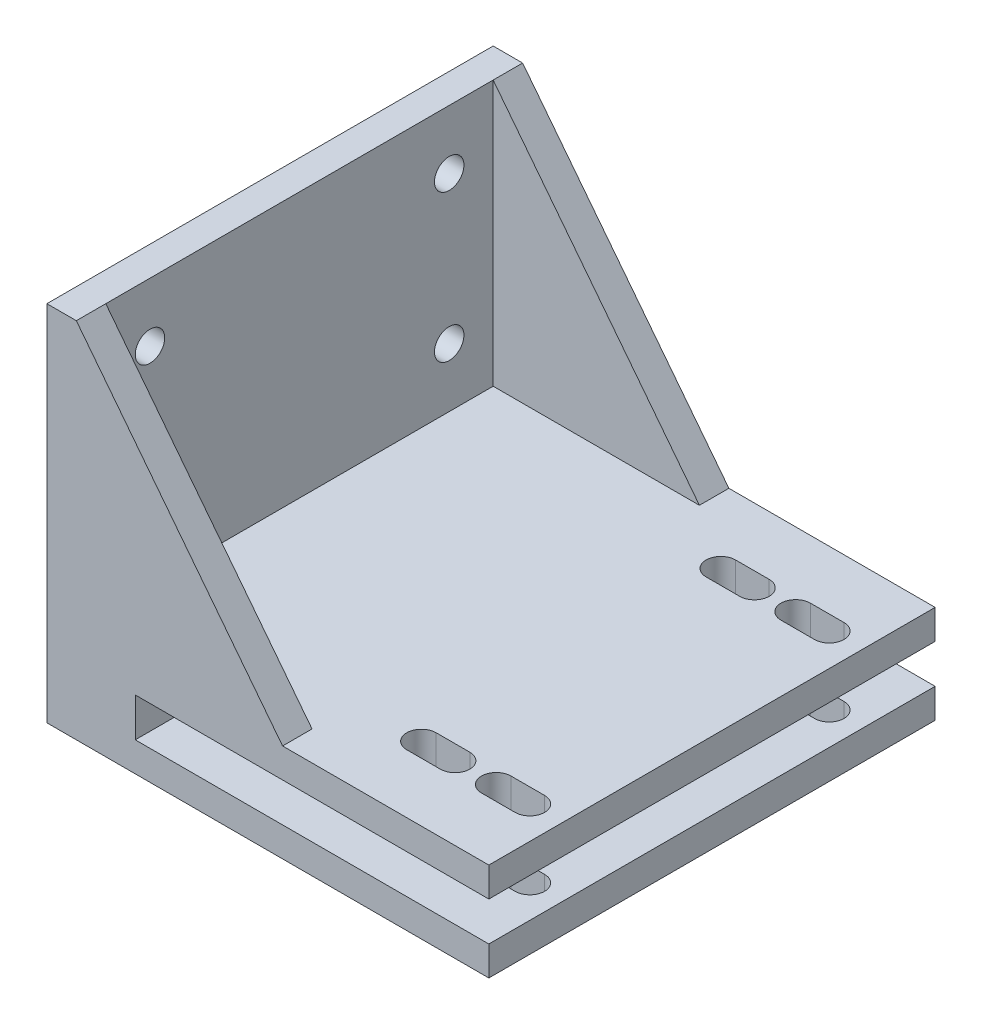
from build123d import *

# Parameters (mm, degrees)
SKETCH1_W                 = 75
SKETCH1_H                 = 15
BOSS_EXTRUDE1_DEPTH       = 5
SKETCH2_W                 = 5
SKETCH2_H                 = 15
BOSS_EXTRUDE2_DEPTH       = 45
F_5_0MM_DOWEL_HOLE1_D     = 5
F_6_0MM_DOWEL_SLOT1_DEPTH = 5
BOSS_EXTRUDE3_DEPTH       = 5
BOSS_EXTRUDE7_DEPTH       = 46.8
BOSS_EXTRUDE11_DEPTH      = 8.935003
SKETCH29_W                = 15
SKETCH29_H                = 75.73500344
BOSS_EXTRUDE12_DEPTH      = 11.6
SKETCH30_W                = 75.73500344
SKETCH30_H                = 5
BOSS_EXTRUDE13_DEPTH      = 60
BOSS_EXTRUDE14_DEPTH      = 5
F_5_0MM_START             = -11.6
F_5_0MM_DOWEL_SLOT2_DEPTH = 16.6
F_5_0MM_DOWEL_SLOT3_DEPTH = 5
F_5_0MM_DOWEL_HOLE2_D     = 5


# Read off the part's stored shape, not the designer's step: Ø6.0mm Dowel Slot1, Ø5.0mm Dowel Slot2, Ø5.0mm Dowel Slot3
with BuildPart() as part:
    # Sketch1 → Boss-Extrude1 (new body)
    with BuildSketch(Plane(origin=(0, 0, 0), x_dir=(1, 0, 0), z_dir=(0, 1, 0))):
        with Locations((37.5, 7.5)):
            Rectangle(SKETCH1_W, SKETCH1_H)
    extrude(amount=BOSS_EXTRUDE1_DEPTH)

    # Sketch2 → Boss-Extrude2 (add)
    with BuildSketch(Plane(origin=(0, 5, 0), x_dir=(1, 0, 0), z_dir=(0, 1, 0))):
        with Locations((2.5, 7.5)):
            Rectangle(SKETCH2_W, SKETCH2_H)
    extrude(amount=BOSS_EXTRUDE2_DEPTH)

    # Ø5.0mm Dowel Hole1 (through all)
    with Locations(Plane.ZY):
        with Locations((-7.5, 40), (-7.5, 15)):
            Hole(F_5_0MM_DOWEL_HOLE1_D / 2)

    # Ø6.0mm Dowel Slot1 outline → Ø6.0mm Dowel Slot1 (cut)
    with BuildSketch(Plane(origin=(0, 0, 0), x_dir=(1, 0, 0), z_dir=(0, 1, 0))):
        with BuildLine():
            ThreePointArc((69.494344615, 4.96500344), (71.994344615, 7.46500344), (69.494344615, 9.96500344))
            Line((69.494344615, 9.96500344), (63.794344615, 9.96500344))
            ThreePointArc((63.794344615, 9.96500344), (61.294344615, 7.46500344), (63.794344615, 4.96500344))
            Line((63.794344615, 4.96500344), (69.494344615, 4.96500344))
        make_face()
        with BuildLine():
            ThreePointArc((56.794348468, 4.974895546), (59.294348468, 7.474895546), (56.794348468, 9.974895546))
            Line((56.794348468, 9.974895546), (51.094348468, 9.974895546))
            ThreePointArc((51.094348468, 9.974895546), (48.594348468, 7.474895546), (51.094348468, 4.974895546))
            Line((51.094348468, 4.974895546), (56.794348468, 4.974895546))
        make_face()
    extrude(amount=F_6_0MM_DOWEL_SLOT1_DEPTH, mode=Mode.SUBTRACT)

    # Sketch10 → Boss-Extrude3 (add)
    with BuildSketch(Plane.XY):
        Polygon((5, 50), (40, 5), (75, 5), (75, 0), (0, 0), (0, 50), align=None)
    extrude(amount=BOSS_EXTRUDE3_DEPTH)

    # Sketch21 → Boss-Extrude7 (add)
    with BuildSketch(Plane(origin=(0, 0, -15), x_dir=(-1, 0, 0), z_dir=(0, 0, -1))):
        Polygon((-75, 5), (-5, 5), (-5, 50), (0, 50), (0, 0), (-75, 0), align=None)
    extrude(amount=BOSS_EXTRUDE7_DEPTH)

    # Sketch22 → Boss-Extrude11 (add)
    with BuildSketch(Plane(origin=(0, 0, -61.8), x_dir=(-1, 0, 0), z_dir=(0, 0, -1))):
        Polygon((-75, 5), (-40, 5), (-5, 5), (-5, 50), (0, 50), (0, 0), (-75, 0), align=None)
    extrude(amount=BOSS_EXTRUDE11_DEPTH)

    # Sketch29 → Boss-Extrude12 (add)
    with BuildSketch(Plane.XZ):
        with Locations((7.5, -32.86750172)):
            Rectangle(SKETCH29_W, SKETCH29_H)
    extrude(amount=BOSS_EXTRUDE12_DEPTH)

    # Sketch30 → Boss-Extrude13 (add)
    with BuildSketch(Plane(origin=(15, 0, 0), x_dir=(0, 0, -1), z_dir=(1, 0, 0))):
        with Locations((32.86750172, -9.1)):
            Rectangle(SKETCH30_W, SKETCH30_H)
    extrude(amount=BOSS_EXTRUDE13_DEPTH)

    # Sketch31 → Boss-Extrude14 (add)
    with BuildSketch(Plane(origin=(0, 0, -70.73500344), x_dir=(-1, 0, 0), z_dir=(0, 0, -1))):
        Polygon((-5, 50), (-40, 5), (-5, 5), align=None)
    extrude(amount=-BOSS_EXTRUDE14_DEPTH)

    # Ø5.0mm Dowel Slot2 outline → Ø5.0mm Dowel Slot2 (cut)
    with BuildSketch(Plane(origin=(0, 0, 0), x_dir=(1, 0, 0), z_dir=(0, 1, 0)).offset(F_5_0MM_START)):
        with BuildLine():
            ThreePointArc((56.794348468, 55.774895546), (59.294348468, 58.274895546), (56.794348468, 60.774895546))
            Line((56.794348468, 60.774895546), (51.094348468, 60.774895546))
            ThreePointArc((51.094348468, 60.774895546), (48.594348468, 58.274895546), (51.094348468, 55.774895546))
            Line((51.094348468, 55.774895546), (56.794348468, 55.774895546))
        make_face()
        with BuildLine():
            ThreePointArc((69.494348468, 55.774895546), (71.994348468, 58.274895546), (69.494348468, 60.774895546))
            Line((69.494348468, 60.774895546), (63.794348468, 60.774895546))
            ThreePointArc((63.794348468, 60.774895546), (61.294348468, 58.274895546), (63.794348468, 55.774895546))
            Line((63.794348468, 55.774895546), (69.494348468, 55.774895546))
        make_face()
    extrude(amount=F_5_0MM_DOWEL_SLOT2_DEPTH, mode=Mode.SUBTRACT)

    # Ø5.0mm Dowel Slot3 outline → Ø5.0mm Dowel Slot3 (cut)
    with BuildSketch(Plane(origin=(0, 0, 0), x_dir=(1, 0, 0), z_dir=(0, 1, 0)).offset(F_5_0MM_START)):
        with BuildLine():
            Line((63.794344615, 4.96500344), (69.494344615, 4.96500344))
            ThreePointArc((69.494344615, 4.96500344), (71.994344615, 7.46500344), (69.494344615, 9.96500344))
            Line((69.494344615, 9.96500344), (63.794344615, 9.96500344))
            ThreePointArc((63.794344615, 9.96500344), (61.294344615, 7.46500344), (63.794344615, 4.96500344))
        make_face()
        with BuildLine():
            Line((51.094348468, 4.974895546), (56.794348468, 4.974895546))
            ThreePointArc((56.794348468, 4.974895546), (59.294348468, 7.474895546), (56.794348468, 9.974895546))
            Line((56.794348468, 9.974895546), (51.094348468, 9.974895546))
            ThreePointArc((51.094348468, 9.974895546), (48.594348468, 7.474895546), (51.094348468, 4.974895546))
        make_face()
    extrude(amount=F_5_0MM_DOWEL_SLOT3_DEPTH, mode=Mode.SUBTRACT)

    # Ø5.0mm Dowel Hole2 (through all)
    with Locations(Plane(origin=(5, 0, 0), x_dir=(0, 0, -1), z_dir=(1, 0, 0))):
        with Locations((58.274895546, 40), (58.274895546, 15)):
            Hole(F_5_0MM_DOWEL_HOLE2_D / 2)


solid = part.part
